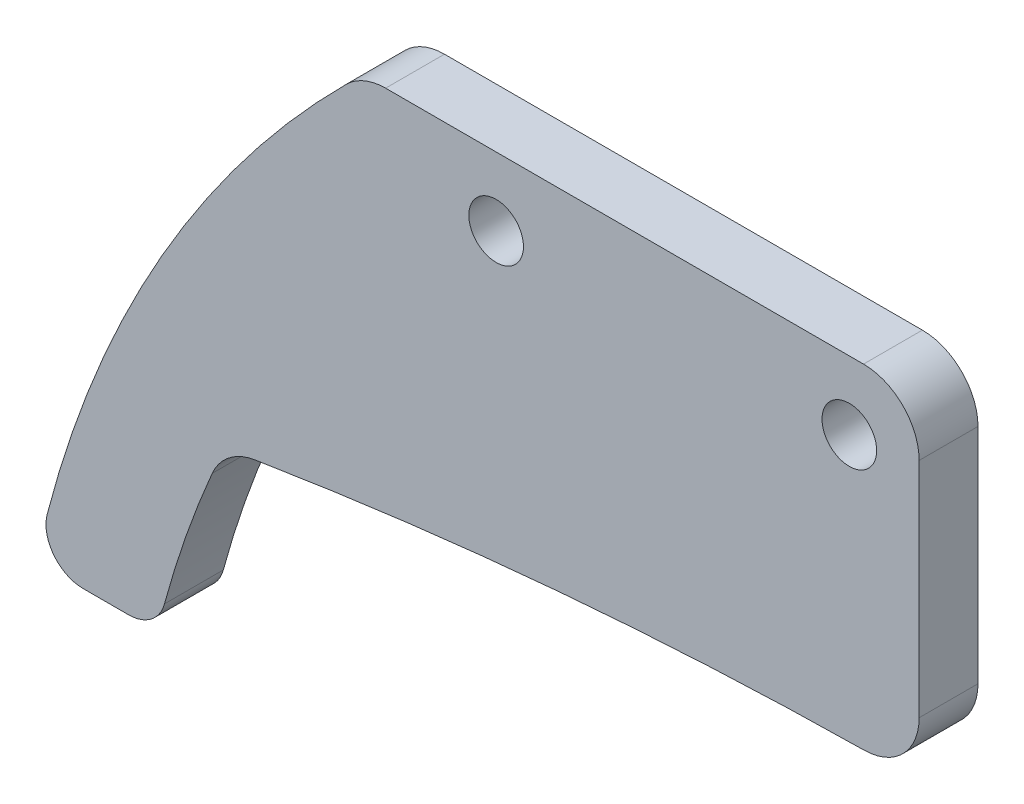
from build123d import *

# Parameters (mm, degrees)
BOSS_EXTRUDE1_DEPTH = 3.175
SKETCH2_R           = 1.4732
CUT_EXTRUDE1_DEPTH  = 79.631516856
FILLET1_R           = 3
FILLET3_R           = 2


with BuildPart() as part:
    # Sketch1 → Boss-Extrude1 (new body)
    with BuildSketch(Plane.XY):
        with BuildLine():
            Line((-17.122741189, 26.5), (-17.122741189, 44.5))
            Line((-17.122741189, 44.5), (-47.122741189, 44.5))
            ThreePointArc((-47.122741189, 44.5), (-54.44861044, 36.091563015), (-60.138258211, 26.5))
            ThreePointArc((-60.138258211, 26.5), (-62.838277553, 19.867096529), (-64.75017234, 12.965635))
            Line((-64.75017234, 12.965635), (-58.20928788, 12.965635))
            ThreePointArc((-58.20928788, 12.965635), (-56.652290629, 18.243467198), (-54.577718421, 23.340123288))
            ThreePointArc((-54.577718421, 23.340123288), (-35.916757127, 25.708630171), (-17.122741189, 26.5))
        make_face()
    extrude(amount=BOSS_EXTRUDE1_DEPTH)

    # Sketch2 → Cut-Extrude1 (cut, through all)
    with BuildSketch(Plane.XY.offset(3.175)):
        with Locations((-20.889565657, 40.81189221)):
            Circle(SKETCH2_R)
        with Locations((-39.939565657, 40.81189221)):
            Circle(SKETCH2_R)
    extrude(amount=-CUT_EXTRUDE1_DEPTH, mode=Mode.SUBTRACT)

    # Fillet1
    fillet1_edges = [part.edges().sort_by_distance(p)[0] for p in [
        (-47.122741189, 44.5, 1.5875),
        (-17.122741189, 26.5, 1.5875),
        (-17.122741189, 44.5, 1.5875),
        (-54.577718421, 23.340123288, 1.5875),
    ]]
    fillet(fillet1_edges, radius=FILLET1_R)

    # Fillet3
    fillet3_edges = [part.edges().sort_by_distance(p)[0] for p in [
        (-64.75017234, 12.965635, 1.5875),
        (-58.20928788, 12.965635, 1.5875),
    ]]
    fillet(fillet3_edges, radius=FILLET3_R)


solid = part.part
